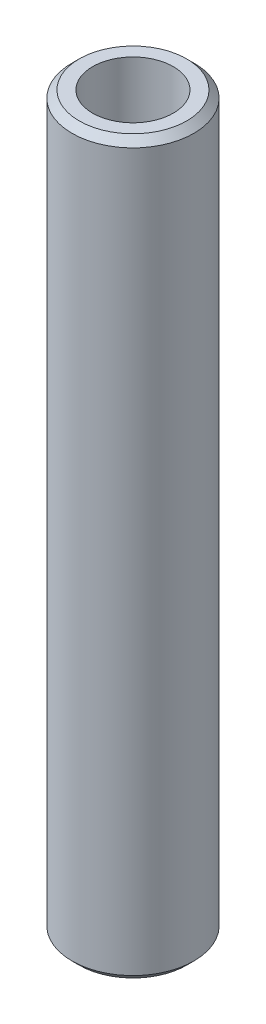
from build123d import *

# Parameters (mm, degrees)
SKETCH1_R           = 50
BOSS_EXTRUDE1_DEPTH = 600
SKETCH2_R           = 33.116125914
CUT_EXTRUDE1_DEPTH  = 605.15229868
CHAMFER1_SIZE       = 5.880364172


with BuildPart() as part:
    # Sketch1 → Boss-Extrude1 (new body)
    with BuildSketch(Plane(origin=(0, 0, 0), x_dir=(1, 0, 0), z_dir=(0, 1, 0))):
        Circle(SKETCH1_R)
    extrude(amount=BOSS_EXTRUDE1_DEPTH)

    # Sketch2 → Cut-Extrude1 (cut, through all)
    with BuildSketch(Plane(origin=(0, 0, 0), x_dir=(1, 0, 0), z_dir=(0, 1, 0))):
        Circle(SKETCH2_R)
    extrude(amount=CUT_EXTRUDE1_DEPTH, mode=Mode.SUBTRACT)

    # Chamfer1
    chamfer1_edges = [part.edges().sort_by_distance(p)[0] for p in [
        (-50, 600, 0),
        (-50, 0, 0),
    ]]
    chamfer(chamfer1_edges, length=CHAMFER1_SIZE)


solid = part.part
